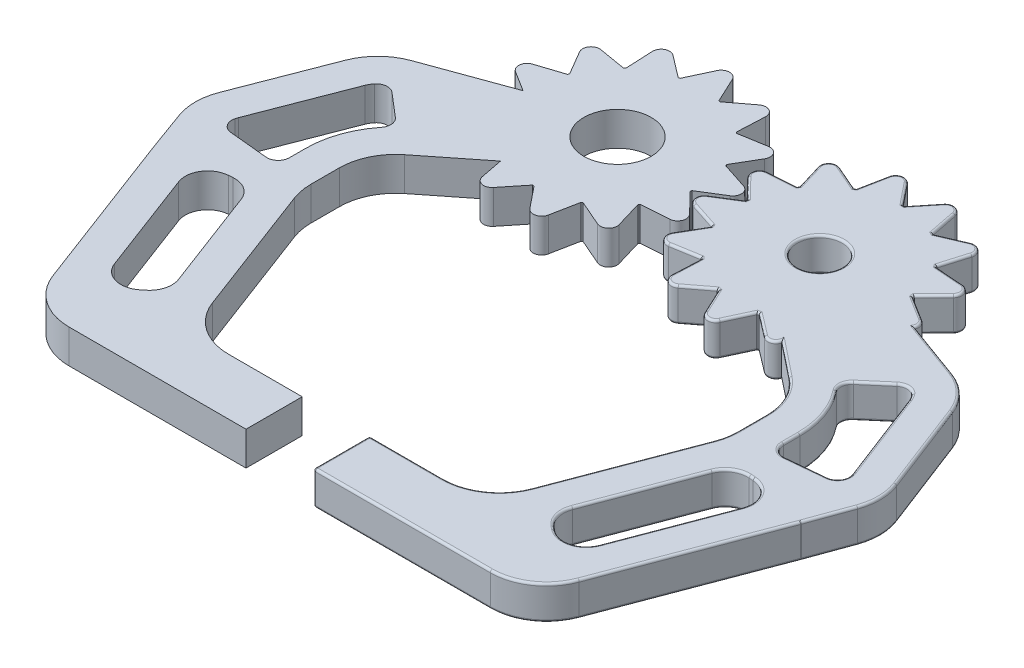
from build123d import *

# Parameters (mm, degrees)
BOSS_EXTRUDE1_DEPTH = 3
BOSS_EXTRUDE2_DEPTH = 3
SKETCH3_R           = 3
CUT_EXTRUDE1_DEPTH  = 3
BOSS_EXTRUDE3_DEPTH = 3
SKETCH5_R           = 1.9999999999999996
CUT_EXTRUDE2_DEPTH  = 10
FILLET1_R           = 0.2


with BuildPart() as part:
    # Sketch1 → Boss-Extrude1 (new body)
    with BuildSketch(Plane(origin=(0, 0, 0), x_dir=(1, 0, 0), z_dir=(0, 1, 0))):
        with BuildLine():
            Line((-8.32026915972251, 9.542312508941123), (-7.2740588316116535, 7.298707219998776))
            ThreePointArc((-7.2740588316116535, 7.298707219998776), (-7.205132517843315, 7.282063630695389), (-7.136366636375814, 7.264769141960864))
            Line((-7.136366636375814, 7.264769141960864), (-5.167338030557971, 8.765184781937645))
            ThreePointArc((-5.167338030557971, 8.765184781937645), (-4.364224257548944, 8.83273271414079), (-3.963594493865928, 8.133411437478186))
            Line((-3.963594493865928, 8.133411437478186), (-4.07987662143101, 5.660599432892145))
            ThreePointArc((-4.07987662143101, 5.660599432892145), (-4.026580063194036, 5.613830611283259), (-3.9737280487528657, 5.5665600034587195))
            Line((-3.9737280487528657, 5.5665600034587195), (-1.532961889453826, 5.980058853319892))
            ThreePointArc((-1.532961889453826, 5.980058853319892), (-0.7904488705394567, 5.6666439968047815), (-0.7606996341986512, 4.86124382392247))
            Line((-0.7606996341986512, 4.86124382392247), (-2.0128353833660646, 2.7257165333282076))
            ThreePointArc((-2.0128353833660646, 2.7257165333282076), (-1.9873781798593884, 2.6595366528190167), (-1.9625477920172012, 2.593119052484485))
            Line((-1.9625477920172012, 2.593119052484485), (0.3908058080885112, 1.8249735089281953))
            ThreePointArc((0.3908058080885112, 1.8249735089281953), (0.9026172885268505, 1.2023954302639746), (0.5546708059969309, 0.4754238346450154))
            Line((0.5546708059969309, 0.4754238346450154), (-1.5464693545101504, -0.8335951755760636))
            ThreePointArc((-1.5464693545101504, -0.8335951755760636), (-1.5546834442645956, -0.9040251019149228), (-1.563563025637423, -0.97437422294166))
            Line((-1.563563025637423, -0.97437422294166), (0.1632530664760889, -2.7481912730439846))
            ThreePointArc((0.1632530664760889, -2.7481912730439846), (0.32711316626695397, -3.5373074389145374), (-0.31881868919576145, -4.019310025671297))
            Line((-0.31881868919576145, -4.019310025671297), (-2.7876173717542465, -4.201940275666751))
            ThreePointArc((-2.7876173717542465, -4.201940275666751), (-2.8276210057975746, -4.260485600483667), (-2.8681763513034584, -4.318650106374195))
            Line((-2.8681763513034584, -4.318650106374195), (-2.1634905234954904, -6.691778553656916))
            ThreePointArc((-2.1634905234954904, -6.691778553656916), (-2.385120178485919, -7.466655803013577), (-3.1810622031176425, -7.5932683970430315))
            Line((-3.1810622031176425, -7.5932683970430315), (-5.451947381802793, -6.607671497472004))
            ThreePointArc((-5.451947381802793, -6.607671497472004), (-5.514576209671734, -6.640920192399074), (-5.577516578400171, -6.673575295812158))
            Line((-5.577516578400171, -6.673575295812158), (-6.056396045663718, -9.102360012300897))
            ThreePointArc((-6.056396045663718, -9.102360012300897), (-6.612742772404009, -9.685483305599218), (-7.376354240502842, -9.427700487456391))
            Line((-7.376354240502842, -9.427700487456391), (-8.929093488011025, -7.49966481028036))
            ThreePointArc((-8.929093488011025, -7.49966481028036), (-8.999999999999998, -7.499999999999999), (-9.070906511988971, -7.499664810280359))
            Line((-9.070906511988971, -7.499664810280359), (-10.62364575949715, -9.42770048745639))
            ThreePointArc((-10.62364575949715, -9.42770048745639), (-11.387257227595983, -9.685483305599224), (-11.943603954336274, -9.102360012300897))
            Line((-11.943603954336274, -9.102360012300897), (-12.422483421599827, -6.673575295812158))
            ThreePointArc((-12.422483421599827, -6.673575295812158), (-12.48542379032826, -6.640920192399076), (-12.548052618197206, -6.6076714974720065))
            Line((-12.548052618197206, -6.6076714974720065), (-14.818937796882352, -7.593268397043037))
            ThreePointArc((-14.818937796882352, -7.593268397043037), (-15.61487982151408, -7.466655803013584), (-15.836509476504505, -6.6917785536569205))
            Line((-15.836509476504505, -6.6917785536569205), (-15.13182364869654, -4.318650106374199))
            ThreePointArc((-15.13182364869654, -4.318650106374199), (-15.172378994202422, -4.260485600483667), (-15.212382628245752, -4.201940275666751))
            Line((-15.212382628245752, -4.201940275666751), (-17.681181310804234, -4.0193100256713))
            ThreePointArc((-17.681181310804234, -4.0193100256713), (-18.32711316626695, -3.5373074389145396), (-18.163253066476084, -2.7481912730439872))
            Line((-18.163253066476084, -2.7481912730439872), (-16.436436974362575, -0.97437422294166))
            ThreePointArc((-16.436436974362575, -0.97437422294166), (-16.445316555735403, -0.9040251019149261), (-16.453530645489845, -0.8335951755760688))
            Line((-16.453530645489845, -0.8335951755760688), (-18.554670805996928, 0.4754238346450085))
            ThreePointArc((-18.554670805996928, 0.4754238346450085), (-18.902617288526848, 1.2023954302639674), (-18.39080580808851, 1.8249735089281884))
            Line((-18.39080580808851, 1.8249735089281884), (-16.0374522079828, 2.59311905248448))
            ThreePointArc((-16.0374522079828, 2.59311905248448), (-16.012621820140613, 2.6595366528190163), (-15.987164616633937, 2.7257165333282085))
            Line((-15.987164616633937, 2.7257165333282085), (-17.23930036580135, 4.861243823922467))
            ThreePointArc((-17.23930036580135, 4.861243823922467), (-17.209551129460547, 5.666643996804776), (-16.467038110546177, 5.980058853319887))
            Line((-16.467038110546177, 5.980058853319887), (-14.026271951247134, 5.566560003458716))
            ThreePointArc((-14.026271951247134, 5.566560003458716), (-13.973419936805964, 5.613830611283257), (-13.920123378568993, 5.66059943289214))
            Line((-13.920123378568993, 5.66059943289214), (-14.036405506134075, 8.133411437478182))
            ThreePointArc((-14.036405506134075, 8.133411437478182), (-13.635775742451063, 8.832732714140782), (-12.832661969442034, 8.765184781937643))
            Line((-12.832661969442034, 8.765184781937643), (-10.863633363624189, 7.264769141960862))
            ThreePointArc((-10.863633363624189, 7.264769141960862), (-10.794867482156684, 7.282063630695389), (-10.725941168388344, 7.298707219998776))
            Line((-10.725941168388344, 7.298707219998776), (-9.679730840277488, 9.542312508941123))
            ThreePointArc((-9.679730840277488, 9.542312508941123), (-9, 9.975348812635602), (-8.32026915972251, 9.542312508941123))
        make_face()
    extrude(amount=BOSS_EXTRUDE1_DEPTH)

    # Sketch3 → Cut-Extrude1 (cut)
    with BuildSketch(Plane(origin=(0, 3, 0), x_dir=(1, 0, 0), z_dir=(0, 1, 0))):
        with Locations((-9, 0)):
            Circle(SKETCH3_R)
    extrude(amount=-CUT_EXTRUDE1_DEPTH, mode=Mode.SUBTRACT)



with BuildPart() as body_2:
    # Sketch2 → Boss-Extrude2 (new body)
    with BuildSketch(Plane(origin=(0, 0, 0), x_dir=(1, 0, 0), z_dir=(0, 1, 0))):
        with BuildLine():
            Line((11.943420646641036, 9.102419289971532), (12.42234902568069, 6.673644217848479))
            ThreePointArc((12.42234902568069, 6.673644217848479), (12.485290052018371, 6.640990381961248), (12.547919549450615, 6.607742948286211))
            Line((12.547919549450615, 6.607742948286211), (14.818784879316434, 7.593385579684269))
            ThreePointArc((14.818784879316434, 7.593385579684269), (15.614729453563658, 7.4667890146908595), (15.836374713308329, 6.691916228761162))
            Line((15.836374713308329, 6.691916228761162), (15.131736676687458, 4.318773590704409))
            ThreePointArc((15.131736676687458, 4.318773590704409), (15.172293193526045, 4.2606099015460295), (15.21229800657128, 4.202065382350745))
            Line((15.21229800657128, 4.202065382350745), (17.681100366512805, 4.019484850083378))
            ThreePointArc((17.681100366512805, 4.019484850083378), (18.327041928612402, 3.537495271467764), (18.163197720403158, 2.7483758058746197))
            Line((18.163197720403158, 2.7483758058746197), (16.436417350502705, 0.9745239807938582))
            ThreePointArc((16.436417350502705, 0.9745239807938582), (16.445298348593486, 0.9041750386020764), (16.45351385669331, 0.8337452776962431))
            Line((16.45351385669331, 0.8337452776962431), (18.554680378341672, -0.4752314186280363))
            ThreePointArc((18.554680378341672, -0.4752314186280363), (18.90264150085632, -1.2021960070091147), (18.390842558257134, -1.8247843926188032))
            Line((18.390842558257134, -1.8247843926188032), (16.03750442786194, -2.59297732882946))
            ThreePointArc((16.03750442786194, -2.59297732882946), (16.012675377569952, -2.6593954291951656), (15.9872195068263, -2.7255758223586524))
            Line((15.9872195068263, -2.7255758223586524), (17.239398261873443, -4.861077896491214))
            ThreePointArc((17.239398261873443, -4.861077896491214), (17.209665245021146, -5.666478668312662), (16.467158537935614, -5.979908477799127))
            Line((16.467158537935614, -5.979908477799127), (14.026384051920298, -5.56645878118228))
            ThreePointArc((14.026384051920298, -5.56645878118228), (13.973532989444935, -5.613730453353005), (13.920237373068682, -5.660500348260586))
            Line((13.920237373068682, -5.660500348260586), (14.036569299123181, -8.133310010607516))
            ThreePointArc((14.036569299123181, -8.133310010607516), (13.6359536187431, -8.832639355176532), (12.832838485588669, -8.765107596425096))
            Line((12.832838485588669, -8.765107596425096), (10.863779664178109, -7.264731609866681))
            ThreePointArc((10.863779664178109, -7.264731609866681), (10.795014131008132, -7.28202748343352), (10.72608815242927, -7.298672460800205))
            Line((10.72608815242927, -7.298672460800205), (9.679923007183724, -9.542298818304783))
            ThreePointArc((9.679923007183724, -9.542298818304783), (9.000200887708619, -9.975348810612823), (8.32046132690441, -9.542326195707528))
            Line((8.32046132690441, -9.542326195707528), (7.274205816352543, -7.298741976237317))
            ThreePointArc((7.274205816352543, -7.298741976237317), (7.205279167422684, -7.28209977500398), (7.136512937685543, -7.264806671108782))
            Line((7.136512937685543, -7.264806671108782), (5.167514548258975, -8.765261963895432))
            ThreePointArc((5.167514548258975, -8.765261963895432), (4.364402135721049, -8.832826069522877), (3.9637582888975738, -8.133512861050301))
            Line((3.9637582888975738, -8.133512861050301), (4.079990617926086, -5.660698515228017))
            ThreePointArc((4.079990617926086, -5.660698515228017), (4.026693117850007, -5.613930766936794), (3.973840151464462, -5.566661223477609))
            Line((3.973840151464462, -5.566661223477609), (1.5330823198715684, -5.980209226415413))
            ThreePointArc((1.5330823198715684, -5.980209226415413), (0.7905629894294881, -5.666809322998758), (0.7607975336122383, -4.861409749382212))
            Line((0.7607975336122383, -4.861409749382212), (2.012890276392112, -2.725857243192335))
            ThreePointArc((2.012890276392112, -2.725857243192335), (1.9874317401327382, -2.6596778753642805), (1.9626000147504232, -2.593260775087857))
            Line((1.9626000147504232, -2.593260775087857), (-0.3907690541113881, -1.8251626244974668))
            ThreePointArc((-0.3907690541113881, -1.8251626244974668), (-0.9025930721813178, -1.2025948530311967), (-0.5546612297772351, -0.47561625046917916))
            Line((-0.5546612297772351, -0.47561625046917916), (1.5464525687364366, 0.8334450731178134))
            ThreePointArc((1.5464525687364366, 0.8334450731178134), (1.5546652401421683, 0.9038751648611306), (1.5635434047934407, 0.9742244646942927))
            Line((1.5635434047934407, 0.9742244646942927), (-0.1633084088328192, 2.7480067390987917))
            ThreePointArc((-0.1633084088328192, 2.7480067390987917), (-0.3271844001388486, 3.5371196049267355), (0.318737748425035, 4.019135199629166))
            Line((0.318737748425035, 4.019135199629166), (2.7875327525992333, 4.201815167278632))
            ThreePointArc((2.7875327525992333, 4.201815167278632), (2.8275352076244387, 4.260361297693441), (2.868089381781175, 4.318526620292534))
            Line((2.868089381781175, 4.318526620292534), (2.1633557630719014, 6.691640875838782))
            ThreePointArc((2.1633557630719014, 6.691640875838782), (2.3849698132181945, 7.4665225883081625), (3.1809092879116303, 7.59315121132231))
            Line((3.1809092879116303, 7.59315121132231), (5.4518143144951265, 6.60760004397802))
            ThreePointArc((5.4518143144951265, 6.60760004397802), (5.514442472775373, 6.6408500001436375), (5.577382183869041, 6.6735063710693305))
            Line((5.577382183869041, 6.6735063710693305), (6.056212739162261, 9.102300730938746))
            ThreePointArc((6.056212739162261, 9.102300730938746), (6.612547722611185, 9.685435228059784), (7.376164381892408, 9.427667787893446))
            Line((7.376164381892408, 9.427667787893446), (8.928942456667253, 7.499663380814869))
            ThreePointArc((8.928942456667253, 7.499663380814869), (8.999848961891665, 7.499999998479167), (9.070755480616457, 7.4996662367043205))
            Line((9.070755480616457, 7.4996662367043205), (10.62345590022824, 9.42773318319588))
            ThreePointArc((10.62345590022824, 9.42773318319588), (11.387062176835007, 9.685531379210657), (11.943420646641036, 9.102419289971532))
        make_face()
    extrude(amount=BOSS_EXTRUDE2_DEPTH)


with BuildPart() as part_1:
    add(part.part)

    add(body_2.part)  # Boss-Extrude3 merges body 2
    # Sketch4 → Boss-Extrude3 (add)
    # profile 1 of 2: a face of its own
    with BuildSketch(Plane(origin=(0, 3, 0), x_dir=(1, 0, 0), z_dir=(0, 1, 0))):
        with BuildLine():
            Line((-12, 0), (-15, 0))
            Line((-15, 0), (-24.063417074059288, -3.298814035697665))
            ThreePointArc((-24.063417074059288, -3.298814035697665), (-25.85454510614932, -4.427767754690947), (-27.017878157162077, -6.196759653877833))
            Line((-27.017878157162077, -6.196759653877833), (-30.146834392646337, -14.302879058208777))
            ThreePointArc((-30.146834392646337, -14.302879058208777), (-30.482039475216727, -16.055114843064764), (-30.180735696844767, -17.81349726058653))
            Line((-30.180735696844767, -17.81349726058653), (-28.845259169497112, -21.48268886368583))
            ThreePointArc((-28.845259169497112, -21.48268886368583), (-28.834592468379938, -21.511715769108086), (-28.823746442220965, -21.54067614665525))
            Line((-28.823746442220965, -21.54067614665525), (-23.42086378400779, -35.832393577627286))
            ThreePointArc((-23.42086378400779, -35.832393577627286), (-21.586408790113275, -38.177725079976085), (-18.743913407354402, -39.0643055780295))
            Line((-18.743913407354402, -39.0643055780295), (-2.9999999999999973, -39.06430557802947))
            Line((-2.9999999999999973, -39.06430557802947), (-2.999999999999995, -34.0643055780295))
            Line((-2.999999999999995, -34.0643055780295), (-9.548771612533102, -34.0643055780295))
            ThreePointArc((-9.548771612533102, -34.0643055780295), (-12.391266995291975, -33.17772507997607), (-14.22572198918649, -30.832393577627283))
            Line((-14.22572198918649, -30.832393577627283), (-18.670113991755716, -19.07607779745121))
            ThreePointArc((-18.670113991755716, -19.07607779745121), (-18.91173819943399, -18.20666886090458), (-18.99316361510232, -17.307989797853402))
            Line((-18.99316361510232, -17.307989797853402), (-18.99316361510232, -14.76495875194751))
            ThreePointArc((-18.99316361510232, -14.76495875194751), (-18.494843488176148, -12.588981196833053), (-17.099212286957545, -10.846737006299845))
            Line((-17.099212286957545, -10.846737006299845), (-11.233353665963485, -6.196759653877833))
            Line((-11.233353665963485, -6.196759653877833), (-12, -5.200385990842216))
            Line((-12, -5.200385990842216), (-12, 0))
        make_face()
        with BuildLine():
            Line((-24.219141077323414, -7.277070145327466), (-27.348097312807674, -15.383189549658415))
            ThreePointArc((-27.348097312807674, -15.383189549658415), (-27.391982380778803, -15.509251337684425), (-27.42736089782193, -15.63795966734096))
            ThreePointArc((-27.42736089782193, -15.63795966734096), (-27.268909504558284, -16.451412967212818), (-26.551328527375524, -16.866009947767477))
            Line((-26.551328527375524, -16.866009947767477), (-23.089675397109268, -17.201667160924675))
            ThreePointArc((-23.089675397109268, -17.201667160924675), (-22.32104449694205, -16.946778355780893), (-21.993163615102315, -16.20633531880675))
            Line((-21.993163615102315, -16.20633531880675), (-21.993163615102315, -14.7649587519475))
            ThreePointArc((-21.993163615102315, -14.7649587519475), (-21.544176267965852, -12.122571967940548), (-20.247611636028644, -9.776784741998526))
            ThreePointArc((-20.247611636028644, -9.776784741998526), (-20.033904843359444, -9.058635962777394), (-20.379087159218226, -8.393611578902545))
            Line((-20.379087159218226, -8.393611578902545), (-22.473694408503057, -6.6004378739851415))
            ThreePointArc((-22.473694408503057, -6.6004378739851415), (-23.209885528261832, -6.363782129162567), (-23.894733418427563, -6.7229014320477685))
            ThreePointArc((-23.894733418427563, -6.7229014320477685), (-24.07932327487177, -6.986881117788997), (-24.219141077323414, -7.277070145327466))
        make_face(mode=Mode.SUBTRACT)
        with BuildLine():
            Line((-21.589342284851647, -32.19339776059977), (-25.07235384075273, -22.98012771297467))
            ThreePointArc((-25.07235384075273, -22.98012771297467), (-24.888606920379818, -21.19868635047283), (-23.352156158021938, -20.278569339637336))
            Line((-23.352156158021938, -20.278569339637336), (-22.96847863119698, -20.249599556982975))
            ThreePointArc((-22.96847863119698, -20.249599556982975), (-21.743690000603678, -20.556889500192728), (-20.94711601260503, -21.536687530642066))
            Line((-20.94711601260503, -21.536687530642066), (-17.545083905804617, -30.53575055629838))
            ThreePointArc((-17.545083905804617, -30.53575055629838), (-17.486354183386762, -31.769285717841722), (-18.16327816241805, -32.8021613646025))
            Line((-18.16327816241805, -32.8021613646025), (-18.46597624014234, -33.04533816922565))
            ThreePointArc((-18.46597624014234, -33.04533816922565), (-20.2448620958945, -33.41567243383988), (-21.589342284851647, -32.19339776059977))
        make_face(mode=Mode.SUBTRACT)
    # profile 2 of 2: a face of its own
    with BuildSketch(Plane(origin=(0, 3, 0), x_dir=(1, 0, 0), z_dir=(0, 1, 0))):
        with BuildLine():
            Line((23.42086378400779, -35.832393577627286), (28.823746442220965, -21.54067614665525))
            ThreePointArc((28.823746442220965, -21.54067614665525), (28.834592468379938, -21.511715769108086), (28.845259169497112, -21.48268886368583))
            Line((28.845259169497112, -21.48268886368583), (30.180735696844767, -17.81349726058653))
            ThreePointArc((30.180735696844767, -17.81349726058653), (30.482039475216727, -16.055114843064764), (30.146834392646337, -14.302879058208777))
            Line((30.146834392646337, -14.302879058208777), (27.017878157162077, -6.196759653877833))
            ThreePointArc((27.017878157162077, -6.196759653877833), (25.85454510614932, -4.427767754690949), (24.063417074059288, -3.298814035697665))
            Line((24.063417074059288, -3.298814035697665), (15, 0))
            Line((15, 0), (12, 0))
            Line((12, 0), (12, -5.200385990842216))
            Line((12, -5.200385990842216), (11.233353665963485, -6.196759653877833))
            Line((11.233353665963485, -6.196759653877833), (17.099212286957545, -10.846737006299845))
            ThreePointArc((17.099212286957545, -10.846737006299845), (18.494843488176148, -12.588981196833053), (18.99316361510232, -14.76495875194751))
            Line((18.99316361510232, -14.76495875194751), (18.99316361510232, -17.307989797853402))
            ThreePointArc((18.99316361510232, -17.307989797853402), (18.91173819943399, -18.20666886090458), (18.670113991755716, -19.07607779745121))
            Line((18.670113991755716, -19.07607779745121), (14.22572198918649, -30.832393577627283))
            ThreePointArc((14.22572198918649, -30.832393577627283), (12.391266995291975, -33.17772507997607), (9.548771612533102, -34.0643055780295))
            Line((9.548771612533102, -34.0643055780295), (2.999999999999995, -34.0643055780295))
            Line((2.999999999999995, -34.0643055780295), (2.9999999999999973, -39.06430557802947))
            Line((2.9999999999999973, -39.06430557802947), (18.743913407354402, -39.0643055780295))
            ThreePointArc((18.743913407354402, -39.0643055780295), (21.586408790113275, -38.177725079976085), (23.42086378400779, -35.832393577627286))
        make_face()
        with BuildLine():
            Line((21.589342284851647, -32.19339776059977), (25.07235384075273, -22.98012771297467))
            ThreePointArc((25.07235384075273, -22.98012771297467), (24.888606920379818, -21.19868635047283), (23.352156158021938, -20.278569339637336))
            Line((23.352156158021938, -20.278569339637336), (22.96847863119698, -20.249599556982975))
            ThreePointArc((22.96847863119698, -20.249599556982975), (21.743690000603678, -20.556889500192728), (20.94711601260503, -21.536687530642066))
            Line((20.94711601260503, -21.536687530642066), (17.545083905804617, -30.53575055629838))
            ThreePointArc((17.545083905804617, -30.53575055629838), (17.486354183386762, -31.769285717841722), (18.16327816241805, -32.8021613646025))
            Line((18.16327816241805, -32.8021613646025), (18.46597624014234, -33.04533816922565))
            ThreePointArc((18.46597624014234, -33.04533816922565), (20.2448620958945, -33.41567243383988), (21.589342284851647, -32.19339776059977))
        make_face(mode=Mode.SUBTRACT)
        with BuildLine():
            Line((24.219141077323414, -7.277070145327466), (27.348097312807674, -15.383189549658415))
            ThreePointArc((27.348097312807674, -15.383189549658415), (27.391982380778803, -15.509251337684427), (27.42736089782193, -15.63795966734096))
            ThreePointArc((27.42736089782193, -15.63795966734096), (27.268909504558284, -16.451412967212818), (26.551328527375524, -16.866009947767477))
            Line((26.551328527375524, -16.866009947767477), (23.089675397109268, -17.201667160924675))
            ThreePointArc((23.089675397109268, -17.201667160924675), (22.32104449694205, -16.946778355780893), (21.993163615102315, -16.20633531880675))
            Line((21.993163615102315, -16.20633531880675), (21.993163615102315, -14.7649587519475))
            ThreePointArc((21.993163615102315, -14.7649587519475), (21.544176267965852, -12.122571967940548), (20.247611636028644, -9.776784741998526))
            ThreePointArc((20.247611636028644, -9.776784741998526), (20.033904843359444, -9.058635962777394), (20.379087159218226, -8.393611578902545))
            Line((20.379087159218226, -8.393611578902545), (22.473694408503057, -6.6004378739851415))
            ThreePointArc((22.473694408503057, -6.6004378739851415), (23.209885528261832, -6.363782129162567), (23.894733418427563, -6.7229014320477685))
            ThreePointArc((23.894733418427563, -6.7229014320477685), (24.07932327487177, -6.986881117788996), (24.219141077323414, -7.277070145327466))
        make_face(mode=Mode.SUBTRACT)
    extrude(amount=-BOSS_EXTRUDE3_DEPTH)

    # Sketch5 → Cut-Extrude2 (cut)
    with BuildSketch(Plane(origin=(0, 3, 0), x_dir=(1, 0, 0), z_dir=(0, 1, 0))):
        with Locations((9, 0)):
            Circle(SKETCH5_R)
    extrude(amount=-CUT_EXTRUDE2_DEPTH, mode=Mode.SUBTRACT)

    # Fillet1
    fillet1_edges = [part_1.edges().sort_by_distance(p)[0] for p in [
        (2.9999999999999973, 1.5, 39.06430557802947),
        (2.999999999999995, 1.5, 34.0643055780295),
        (18.314627201280196, 0, 32.92374976691407),
        (17.486354183386762, 0, 31.769285717841722),
        (19.246099959204823, 0, 26.036219043470226),
        (21.743690000603678, 0, 20.556889500192728),
        (23.160317394609457, 0, 20.264084448310157),
        (24.888606920379818, 0, 21.19868635047283),
        (23.330848062802186, 0, 27.58676273678722),
        (20.2448620958945, 0, 33.41567243383988),
        (25.783619195065544, 0, 11.330129847492941),
        (27.391982380778803, 0, 15.509251337684427),
        (27.268909504558284, 0, 16.451412967212818),
        (24.820501962242396, 0, 17.033838554346076),
        (22.32104449694205, 0, 16.946778355780893),
        (21.993163615102315, 0, 15.485647035377125),
        (21.544176267965852, 0, 12.122571967940548),
        (20.033904843359444, 0, 9.058635962777396),
        (21.42639078386064, 0, 7.497024726443843),
        (23.209885528261832, 0, 6.363782129162568),
        (24.07932327487177, 0, 6.986881117788997),
        (18.494843488176148, 0, 12.588981196833053),
        (18.99316361510232, 0, 16.036474274900456),
        (18.91173819943399, 0, 18.20666886090458),
        (16.447917990471105, 0, 24.954235687539246),
        (12.391266995291971, 0, 33.17772507997607),
        (6.274385806266548, 0, 34.0643055780295),
        (2.9999999999999964, 0, 36.56430557802948),
        (10.8719567036772, 0, 39.06430557802948),
        (21.58640879011328, 0, 38.177725079976085),
        (26.12230511311438, 0, 28.68653486214127),
        (28.834592468379938, 0, 21.511715769108083),
        (29.512997433170938, 0, 19.64809306213618),
        (30.482039475216727, 0, 16.055114843064764),
        (28.582356274904207, 0, 10.249819356043306),
        (25.854545106149317, 0, 4.427767754690948),
        (21.456704966161382, 0, 2.3500484191215163),
        (18.872655121514846, 0, 0.8839435158621627),
        (17.50409711751749, 0, -0.17925692953410333),
        (16.445298348593486, 0, -0.9041750386020764),
        (17.29980753545293, 0, -1.861449893334239),
        (18.327041928612402, 0, -3.537495271467764),
        (16.44669918654204, 0, -4.110775116217061),
        (15.172293193526043, 0, -4.260609901546028),
        (15.484055694997894, 0, -5.505344909732786),
        (15.61472945356366, 0, -7.466789014690859),
        (13.683352214383525, 0, -7.10056426398524),
        (12.485290052018373, 0, -6.640990381961247),
        (12.182884836160863, 0, -7.888031753910006),
        (11.387062176835007, 0, -9.685531379210657),
        (9.84710569042235, 0, -8.4636997099501),
        (8.999848961891665, 0, -7.499999998479167),
        (8.15255341927983, 0, -8.463665584354157),
        (6.612547722611185, 0, -9.685435228059784),
        (5.816797461515651, 0, -7.8879035510040385),
        (5.514442472775372, 0, -6.640850000143638),
        (4.316361801203378, 0, -7.100375627650164),
        (2.3849698132181945, 0, -7.4665225883081625),
        (2.5157225724265384, 0, -5.505083748065658),
        (2.8275352076244387, 0, -4.260361297693441),
        (1.5531352505121343, 0, -4.110475183453898),
        (-0.3271844001388491, 0, -3.5371196049267346),
        (0.7001174979803108, 0, -1.8611156018965422),
        (1.5546652401421692, 0, -0.9038751648611328),
        (0.49589566947960084, 0, -0.17891441132431712),
        (-0.9025930721813178, 0, 1.2025948530311976),
        (0.7859154803195176, 0, 2.209211699792662),
        (1.9874317401327373, 0, 2.659677875364279),
        (1.3868439050021752, 0, 3.7936334962872738),
        (0.7905629894294885, 0, 5.666809322998759),
        (2.753461235668015, 0, 5.77343522494651),
        (4.026693117850004, 0, 5.613930766936791),
        (4.021874453411829, 0, 6.897105688139159),
        (4.3644021357210505, 0, 8.832826069522879),
        (6.152013742972259, 0, 8.015034317502106),
        (7.205279167422683, 0, 7.28209977500398),
        (7.797333571628476, 0, 8.420534085972422),
        (9.00020088770862, 0, 9.975348810612823),
        (10.203005579806497, 0, 8.420485639552494),
        (10.795014131008132, 0, 7.282027483433519),
        (11.848309074883389, 0, 8.014919603145888),
        (13.514943156045728, 0, 8.883203318631224),
        (15.55120316981654, 0, 9.619600827073517),
        (7, 0, -2.4e-16),
        (24.888606920379818, 3, 21.19868635047283),
        (23.160317394609457, 3, 20.264084448310157),
        (21.743690000603678, 3, 20.556889500192728),
        (19.246099959204823, 3, 26.036219043470226),
        (17.486354183386762, 3, 31.769285717841722),
        (18.314627201280196, 3, 32.92374976691407),
        (20.2448620958945, 3, 33.41567243383988),
        (23.330848062802186, 3, 27.58676273678722),
        (21.42639078386064, 3, 7.497024726443843),
        (20.033904843359444, 3, 9.058635962777396),
        (21.544176267965852, 3, 12.122571967940548),
        (21.993163615102315, 3, 15.485647035377125),
        (22.32104449694205, 3, 16.946778355780893),
        (24.820501962242396, 3, 17.033838554346076),
        (27.268909504558284, 3, 16.451412967212818),
        (27.391982380778803, 3, 15.509251337684427),
        (25.783619195065544, 3, 11.330129847492941),
        (24.07932327487177, 3, 6.986881117788997),
        (23.209885528261832, 3, 6.363782129162568),
        (11.848309074883389, 3, 8.014919603145888),
        (10.795014131008132, 3, 7.282027483433519),
        (10.203005579806497, 3, 8.420485639552494),
        (9.00020088770862, 3, 9.975348810612823),
        (7.797333571628476, 3, 8.420534085972422),
        (7.205279167422683, 3, 7.28209977500398),
        (6.152013742972259, 3, 8.015034317502106),
        (4.3644021357210505, 3, 8.832826069522879),
        (4.021874453411829, 3, 6.897105688139159),
        (4.026693117850004, 3, 5.613930766936791),
        (2.753461235668015, 3, 5.77343522494651),
        (0.7905629894294885, 3, 5.666809322998759),
        (1.3868439050021752, 3, 3.7936334962872738),
        (1.9874317401327373, 3, 2.659677875364279),
        (0.7859154803195176, 3, 2.209211699792662),
        (-0.9025930721813178, 3, 1.2025948530311976),
        (0.49589566947960084, 3, -0.17891441132431712),
        (1.5546652401421692, 3, -0.9038751648611328),
        (0.7001174979803108, 3, -1.8611156018965422),
        (-0.3271844001388491, 3, -3.5371196049267346),
        (1.5531352505121343, 3, -4.110475183453898),
        (2.8275352076244387, 3, -4.260361297693441),
        (2.5157225724265384, 3, -5.505083748065658),
        (2.3849698132181945, 3, -7.4665225883081625),
        (4.316361801203378, 3, -7.100375627650164),
        (5.514442472775372, 3, -6.640850000143638),
        (5.816797461515651, 3, -7.8879035510040385),
        (6.612547722611185, 3, -9.685435228059784),
        (8.15255341927983, 3, -8.463665584354157),
        (8.999848961891665, 3, -7.499999998479167),
        (9.84710569042235, 3, -8.4636997099501),
        (11.387062176835007, 3, -9.685531379210657),
        (12.182884836160863, 3, -7.888031753910006),
        (12.485290052018373, 3, -6.640990381961247),
        (13.683352214383525, 3, -7.10056426398524),
        (15.61472945356366, 3, -7.466789014690859),
        (15.484055694997894, 3, -5.505344909732786),
        (15.172293193526043, 3, -4.260609901546028),
        (16.44669918654204, 3, -4.110775116217061),
        (18.327041928612402, 3, -3.537495271467764),
        (17.29980753545293, 3, -1.861449893334239),
        (16.445298348593486, 3, -0.9041750386020764),
        (17.50409711751749, 3, -0.17925692953410333),
        (18.872655121514846, 3, 0.8839435158621627),
        (21.456704966161382, 3, 2.3500484191215163),
        (25.854545106149317, 3, 4.427767754690948),
        (28.582356274904207, 3, 10.249819356043306),
        (30.482039475216727, 3, 16.055114843064764),
        (29.512997433170938, 3, 19.64809306213618),
        (28.834592468379938, 3, 21.511715769108083),
        (26.12230511311438, 3, 28.68653486214127),
        (21.58640879011328, 3, 38.177725079976085),
        (10.8719567036772, 3, 39.06430557802948),
        (2.9999999999999964, 3, 36.56430557802948),
        (6.274385806266548, 3, 34.0643055780295),
        (12.391266995291971, 3, 33.17772507997607),
        (16.447917990471105, 3, 24.954235687539246),
        (18.91173819943399, 3, 18.20666886090458),
        (18.99316361510232, 3, 16.036474274900456),
        (18.494843488176148, 3, 12.588981196833053),
        (15.55120316981654, 3, 9.619600827073517),
        (13.514943156045728, 3, 8.883203318631224),
        (7, 3, -2.4e-16),
    ]]
    fillet(fillet1_edges, radius=FILLET1_R)


solid = part_1.part
